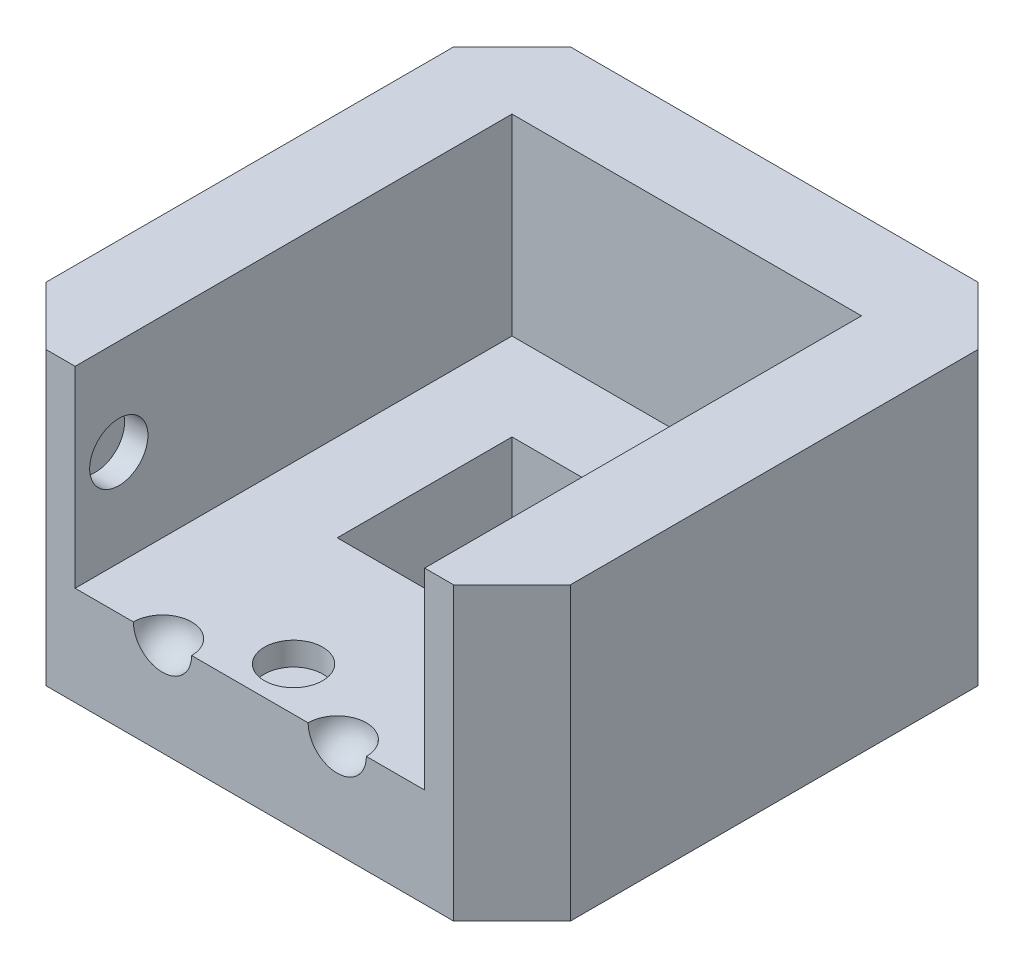
from build123d import *

# Parameters (mm, degrees)
SKETCH1_W           = 114.3
SKETCH1_H           = 114.3
SKETCH1_W_2         = 38.1
SKETCH1_H_2         = 38.1
BOSS_EXTRUDE1_DEPTH = 76.2
SKETCH3_W           = 76.2
SKETCH3_H           = 76.2
CUT_EXTRUDE2_DEPTH  = 54.61
SKETCH5_W           = 114.3
SKETCH5_H           = 114.3
SKETCH5_W_2         = 76.2
SKETCH5_H_2         = 76.2
CUT_EXTRUDE3_DEPTH  = 12.7
CHAMFER1_SIZE       = 12.7
CUT_EXTRUDE4_REACH  = 144.699
SKETCH6_W           = 76.2
SKETCH6_H           = 41.91
SKETCH7_R           = 6.35
CUT_EXTRUDE5_DEPTH  = 5.08
SKETCH9_R           = 6.35
CUT_EXTRUDE6_DEPTH  = 5.08
CUT_EXTRUDE7_START  = -5.08
SKETCH8_R           = 6.35
CUT_EXTRUDE7_DEPTH  = 5.08


with BuildPart() as part:
    # Sketch1 → Boss-Extrude1 (new body)
    with BuildSketch(Plane(origin=(0, 0, 0), x_dir=(1, 0, 0), z_dir=(0, 1, 0))):
        Rectangle(SKETCH1_W, SKETCH1_H)
        Rectangle(SKETCH1_W_2, SKETCH1_H_2, mode=Mode.SUBTRACT)
    extrude(amount=BOSS_EXTRUDE1_DEPTH)

    # Sketch3 → Cut-Extrude2 (cut)
    with BuildSketch(Plane(origin=(0, 76.2, 0), x_dir=(1, 0, 0), z_dir=(0, 1, 0))):
        Rectangle(SKETCH3_W, SKETCH3_H)
    extrude(amount=-CUT_EXTRUDE2_DEPTH, mode=Mode.SUBTRACT)

    # Sketch5 → Cut-Extrude3 (cut)
    with BuildSketch(Plane(origin=(0, 76.2, 0), x_dir=(1, 0, 0), z_dir=(0, 1, 0))):
        Rectangle(SKETCH5_W, SKETCH5_H)
        Rectangle(SKETCH5_W_2, SKETCH5_H_2, mode=Mode.SUBTRACT)
    extrude(amount=-CUT_EXTRUDE3_DEPTH, mode=Mode.SUBTRACT)

    # Chamfer1
    chamfer1_edges = [part.edges().sort_by_distance(p)[0] for p in [
        (-57.15, 31.75, 57.15),
        (-57.15, 31.75, -57.15),
        (57.15, 31.75, -57.15),
        (57.15, 31.75, 57.15),
    ]]
    chamfer(chamfer1_edges, length=CHAMFER1_SIZE)

    # Sketch6 → Cut-Extrude4 (cut, up to next)
    with BuildSketch(Plane.XY.offset(57.15), mode=Mode.PRIVATE) as cut_extrude4_sk1:
        with Locations((0, 42.545)):
            Rectangle(SKETCH6_W, SKETCH6_H)
    cut_extrude4_tool1 = extrude(cut_extrude4_sk1.sketch, amount=-CUT_EXTRUDE4_REACH, mode=Mode.PRIVATE) & part.part
    add(cut_extrude4_tool1.solids().sort_by_distance((0, 42.545, 57.15))[0], mode=Mode.SUBTRACT)

    # Sketch7 → Cut-Extrude5 (cut)
    with BuildSketch(Plane(origin=(0, 21.59, 0), x_dir=(1, 0, 0), z_dir=(0, 1, 0))):
        with Locations((0, -47.625)):
            Circle(SKETCH7_R)
    extrude(amount=-CUT_EXTRUDE5_DEPTH, mode=Mode.SUBTRACT)

    # Sketch9 → Cut-Extrude6 (cut)
    with BuildSketch(Plane.ZY.offset(-38.1)):
        with Locations((47.625, 42.545)):
            Circle(SKETCH9_R)
    extrude(amount=-CUT_EXTRUDE6_DEPTH, mode=Mode.SUBTRACT)

    # Sketch8 → Cut-Extrude7 (cut)
    with BuildSketch(Plane(origin=(-38.1, 0, 0), x_dir=(0, 0, -1), z_dir=(1, 0, 0)).offset(CUT_EXTRUDE7_START)):
        with Locations((-47.625, 42.545)):
            Circle(SKETCH8_R)
    extrude(amount=CUT_EXTRUDE7_DEPTH, mode=Mode.SUBTRACT)

    # Sketch10 → Cut-Revolve1 (revolve, cut)
    with BuildSketch(Plane.XY.offset(57.15)):
        with BuildLine():
            Line((-12.7, 21.59), (-25.4, 21.59))
            ThreePointArc((-25.4, 21.59), (-19.05, 15.24), (-12.7, 21.59))
        make_face()
        with BuildLine():
            ThreePointArc((12.7, 21.59), (19.05, 15.24), (25.4, 21.59))
            Line((25.4, 21.59), (12.7, 21.59))
        make_face()
    revolve(axis=Axis((-25.4, 21.59, 57.15), (1, 0, 0)), mode=Mode.SUBTRACT)


solid = part.part
